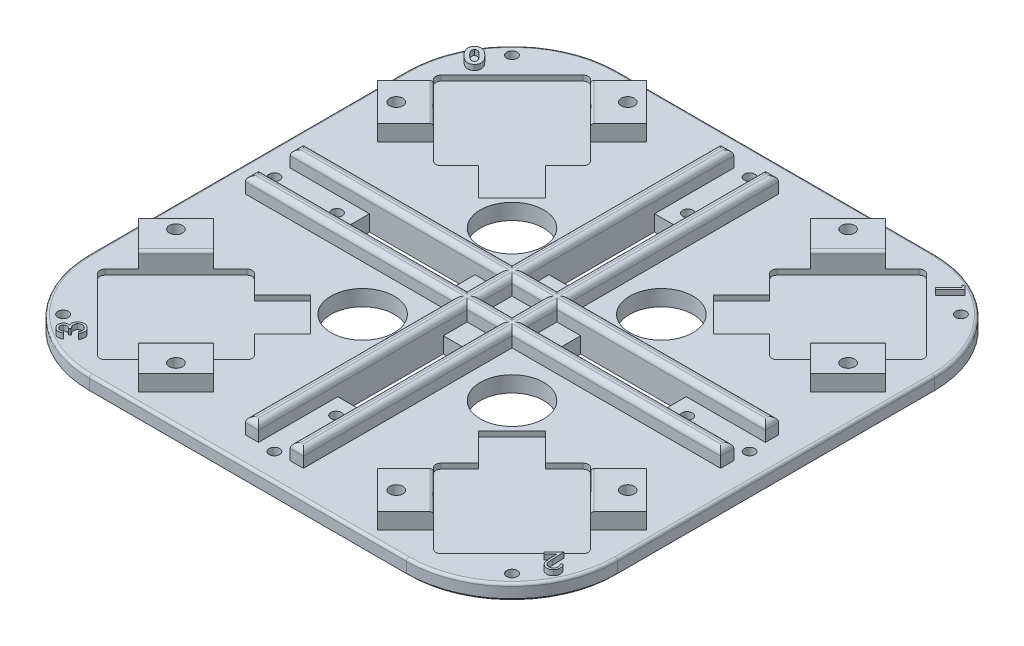
from build123d import *

# Parameters (mm, degrees)
SKETCH_1_W          = 200
SKETCH_1_H          = 200
SKETCH_1_R          = 2
EXTRUDE_1_DEPTH     = 6
CUT_EXTRUDE_1_DEPTH = 2
FILLET_1_R          = 2
EXTRUDE_3_DEPTH     = 6
FILLET_4_R          = 40
SKETCH_4_R          = 2.5
CUT_EXTRUDE_2_DEPTH = 8
SKETCH_5_W          = 5
SKETCH_5_H          = 180
EXTRUDE_4_DEPTH     = 6
SKETCH_6_W          = 180
SKETCH_6_H          = 5
EXTRUDE_5_DEPTH     = 6
FILLET_5_R          = 2
SKETCH_7_R          = 12
SKETCH_7_W          = 40
SKETCH_7_H          = 12
SKETCH_7_W_2        = 12
SKETCH_7_H_2        = 40
CUT_EXTRUDE_3_DEPTH = 6
CUT_EXTRUDE_4_DEPTH = 2
FILLET_6_R          = 1
SKETCH_9_R          = 2
CUT_EXTRUDE_5_DEPTH = 10
EXTRUDE_6_DEPTH     = 2
FILLET_9_R          = 1
CHAMFER_1_SIZE      = 1


with BuildPart() as part:
    # Эскиз1 → Бобышка-Вытянуть1 (new body)
    with BuildSketch(Plane(origin=(0, 0, 0), x_dir=(1, 0, 0), z_dir=(0, 1, 0))):
        Rectangle(SKETCH_1_W, SKETCH_1_H)
        with Locations((-90, 0)):
            Circle(SKETCH_1_R, mode=Mode.SUBTRACT)
        with Locations((0, 90)):
            Circle(SKETCH_1_R, mode=Mode.SUBTRACT)
        with Locations((90, 0)):
            Circle(SKETCH_1_R, mode=Mode.SUBTRACT)
        with Locations((0, -90)):
            Circle(SKETCH_1_R, mode=Mode.SUBTRACT)
        with Locations((-85, 85)):
            Circle(SKETCH_1_R, mode=Mode.SUBTRACT)
        with Locations((85, 85)):
            Circle(SKETCH_1_R, mode=Mode.SUBTRACT)
        with Locations((85, -85)):
            Circle(SKETCH_1_R, mode=Mode.SUBTRACT)
        with Locations((-85, -85)):
            Circle(SKETCH_1_R, mode=Mode.SUBTRACT)
    extrude(amount=EXTRUDE_1_DEPTH)

    # Эскиз2 → Вырез-Вытянуть1 (cut)
    with BuildSketch(Plane(origin=(0, 6, 0), x_dir=(1, 0, 0), z_dir=(0, 1, 0))):
        Polygon((63.639610307, 33.941125497), (33.941125497, 63.639610307), (63.639610307, 93.338095117), (93.338095117, 63.639610307), align=None)
        Polygon((33.941125497, -63.639610307), (63.639610307, -33.941125497), (93.338095117, -63.639610307), (63.639610307, -93.338095117), align=None)
        Polygon((-63.639610307, -33.941125497), (-33.941125497, -63.639610307), (-63.639610307, -93.338095117), (-93.338095117, -63.639610307), align=None)
        Polygon((-33.941125497, 63.639610307), (-63.639610307, 33.941125497), (-93.338095117, 63.639610307), (-63.639610307, 93.338095117), align=None)
    extrude(amount=-CUT_EXTRUDE_1_DEPTH, mode=Mode.SUBTRACT)

    # Скругление1
    fillet_1_edges = [part.edges().sort_by_distance(p)[0] for p in [
        (63.639610307, 5, -33.941125497),
        (33.941125497, 5, -63.639610307),
        (93.338095117, 5, -63.639610307),
        (63.639610307, 5, -93.338095117),
        (-63.639610307, 5, -93.338095117),
        (-63.639610307, 5, -33.941125497),
        (-93.338095117, 5, -63.639610307),
        (-33.941125497, 5, -63.639610307),
        (63.639610307, 5, 93.338095117),
        (93.338095117, 5, 63.639610307),
        (63.639610307, 5, 33.941125497),
        (33.941125497, 5, 63.639610307),
        (-63.639610307, 5, 93.338095117),
        (-33.941125497, 5, 63.639610307),
        (-63.639610307, 5, 33.941125497),
        (-93.338095117, 5, 63.639610307),
    ]]
    fillet(fillet_1_edges, radius=FILLET_1_R)

    # Эскиз3 → Бобышка-Вытянуть3 (add)
    with BuildSketch(Plane(origin=(0, 6, 0), x_dir=(1, 0, 0), z_dir=(0, 1, 0))):
        Polygon((41.71930009, 71.4177849), (55.861435714, 85.559920524), (45.254833996, 96.166522241), (31.112698372, 82.024386618), align=None)
        Polygon((85.559920524, 55.861435714), (96.166522241, 45.254833996), (82.024386618, 31.112698372), (71.4177849, 41.71930009), align=None)
        Polygon((71.4177849, -41.71930009), (85.559920524, -55.861435714), (96.166522241, -45.254833996), (82.024386618, -31.112698372), align=None)
        Polygon((31.112698372, -82.024386618), (45.254833996, -96.166522241), (55.861435714, -85.559920524), (41.71930009, -71.4177849), align=None)
        Polygon((-41.71930009, -71.4177849), (-55.861435714, -85.559920524), (-45.254833996, -96.166522241), (-31.112698372, -82.024386618), align=None)
        Polygon((-85.559920524, -55.861435714), (-96.166522241, -45.254833996), (-82.024386618, -31.112698372), (-71.4177849, -41.71930009), align=None)
        Polygon((-71.4177849, 41.71930009), (-85.559920524, 55.861435714), (-96.166522241, 45.254833996), (-82.024386618, 31.112698372), align=None)
        Polygon((-31.112698372, 82.024386618), (-45.254833996, 96.166522241), (-55.861435714, 85.559920524), (-41.71930009, 71.4177849), align=None)
    extrude(amount=EXTRUDE_3_DEPTH)

    # Скругление4
    fillet_4_edges = [part.edges().sort_by_distance(p)[0] for p in [
        (100, 3, -100),
        (100, 3, 100),
        (-100, 3, 100),
        (-100, 3, -100),
    ]]
    fillet(fillet_4_edges, radius=FILLET_4_R)

    # Эскиз4 → Вырез-Вытянуть2 (cut)
    with BuildSketch(Plane(origin=(0, 12, 0), x_dir=(1, 0, 0), z_dir=(0, 1, 0))):
        with Locations((41.71930009, 85.559920524)):
            Circle(SKETCH_4_R)
        with Locations((85.559920524, 41.71930009)):
            Circle(SKETCH_4_R)
        with Locations((85.559920524, -41.71930009)):
            Circle(SKETCH_4_R)
        with Locations((41.71930009, -85.559920524)):
            Circle(SKETCH_4_R)
        with Locations((-41.71930009, -85.559920524)):
            Circle(SKETCH_4_R)
        with Locations((-85.559920524, -41.71930009)):
            Circle(SKETCH_4_R)
        with Locations((-85.559920524, 41.71930009)):
            Circle(SKETCH_4_R)
        with Locations((-41.71930009, 85.559920524)):
            Circle(SKETCH_4_R)
    extrude(amount=-CUT_EXTRUDE_2_DEPTH, mode=Mode.SUBTRACT)

    # Эскиз5 → Бобышка-Вытянуть4 (add)
    with BuildSketch(Plane(origin=(0, 6, 0), x_dir=(1, 0, 0), z_dir=(0, 1, 0))):
        with Locations((-8.5, 0)):
            Rectangle(SKETCH_5_W, SKETCH_5_H)
        with Locations((8.5, 0)):
            Rectangle(SKETCH_5_W, SKETCH_5_H)
    extrude(amount=EXTRUDE_4_DEPTH)

    # Эскиз6 → Бобышка-Вытянуть5 (add)
    with BuildSketch(Plane(origin=(0, 6, 0), x_dir=(1, 0, 0), z_dir=(0, 1, 0))):
        with Locations((0, 8.5)):
            Rectangle(SKETCH_6_W, SKETCH_6_H)
        with Locations((0, -8.5)):
            Rectangle(SKETCH_6_W, SKETCH_6_H)
    extrude(amount=EXTRUDE_5_DEPTH)

    # Скругление5
    fillet_5_edges = [part.edges().sort_by_distance(p)[0] for p in [
        (-8.5, 12, 90),
        (-11, 12, -50.5),
        (-11, 12, 50.5),
        (-8.5, 12, -90),
        (-6, 12, -50.5),
        (-6, 12, 50.5),
        (8.5, 12, 90),
        (6, 12, -50.5),
        (6, 12, 50.5),
        (8.5, 12, -90),
        (11, 12, -50.5),
        (11, 12, 50.5),
        (0, 12, -6),
        (-6, 12, 0),
        (0, 12, 6),
        (6, 12, 0),
        (-50.5, 12, 11),
        (-90, 12, 8.5),
        (-50.5, 12, 6),
        (-11, 12, 0),
        (-50.5, 12, -6),
        (-90, 12, -8.5),
        (-50.5, 12, -11),
        (0, 12, -11),
        (50.5, 12, -11),
        (90, 12, -8.5),
        (50.5, 12, -6),
        (11, 12, 0),
        (50.5, 12, 6),
        (90, 12, 8.5),
        (50.5, 12, 11),
        (0, 12, 11),
    ]]
    fillet(fillet_5_edges, radius=FILLET_5_R)

    # Эскиз7 → Вырез-Вытянуть3 (cut)
    with BuildSketch(Plane(origin=(0, 6, 0), x_dir=(1, 0, 0), z_dir=(0, 1, 0))):
        with Locations((28.284271247, 28.284271247)):
            Circle(SKETCH_7_R)
        with Locations((28.284271247, -28.284271247)):
            Circle(SKETCH_7_R)
        with Locations((-28.284271247, -28.284271247)):
            Circle(SKETCH_7_R)
        with Locations((-28.284271247, 28.284271247)):
            Circle(SKETCH_7_R)
        with Locations((40, 0)):
            Rectangle(SKETCH_7_W, SKETCH_7_H)
        with Locations((0, 40)):
            Rectangle(SKETCH_7_W_2, SKETCH_7_H_2)
        with Locations((0, -40)):
            Rectangle(SKETCH_7_W_2, SKETCH_7_H_2)
        with Locations((-40, 0)):
            Rectangle(SKETCH_7_W, SKETCH_7_H)
    extrude(amount=-CUT_EXTRUDE_3_DEPTH, mode=Mode.SUBTRACT)

    # Эскиз8 → Вырез-Вытянуть4 (cut)
    with BuildSketch(Plane(origin=(0, 6, 0), x_dir=(1, 0, 0), z_dir=(0, 1, 0))):
        Polygon((44.547727215, 31.819805153), (31.819805153, 44.547727215), (53.033008589, 65.76093065), (65.76093065, 53.033008589), align=None)
        Polygon((65.76093065, -53.033008589), (53.033008589, -65.76093065), (31.819805153, -44.547727215), (44.547727215, -31.819805153), align=None)
        Polygon((-44.547727215, -31.819805153), (-31.819805153, -44.547727215), (-53.033008589, -65.76093065), (-65.76093065, -53.033008589), align=None)
        Polygon((-65.76093065, 53.033008589), (-53.033008589, 65.76093065), (-31.819805153, 44.547727215), (-44.547727215, 31.819805153), align=None)
    extrude(amount=-CUT_EXTRUDE_4_DEPTH, mode=Mode.SUBTRACT)

    # Скругление6
    fillet_6_edges = [part.edges().sort_by_distance(p)[0] for p in [
        (78.488852712, 12, -48.790367902),
        (48.790367902, 12, -78.488852712),
        (-78.488852712, 12, 48.790367902),
        (-48.790367902, 12, 78.488852712),
        (48.790367902, 12, 78.488852712),
        (78.488852712, 12, 48.790367902),
        (-78.488852712, 12, -48.790367902),
        (-48.790367902, 12, -78.488852712),
    ]]
    fillet(fillet_6_edges, radius=FILLET_6_R)

    # Эскиз9 → Вырез-Вытянуть5 (cut)
    with BuildSketch(Plane(origin=(0, 6, 0), x_dir=(1, 0, 0), z_dir=(0, 1, 0))):
        with Locations((0.141931936, 66.467885895)):
            Circle(SKETCH_9_R)
        with Locations((-0.141931936, -66.467885895)):
            Circle(SKETCH_9_R)
        with Locations((66.467885895, -0.141931936)):
            Circle(SKETCH_9_R)
        with Locations((-66.467885895, 0.141931936)):
            Circle(SKETCH_9_R)
    extrude(amount=-CUT_EXTRUDE_5_DEPTH, mode=Mode.SUBTRACT)

    # Эскиз10 → Бобышка-Вытянуть6 (add)
    # profile 1 of 4: a face of its own
    with BuildSketch(Plane(origin=(0, 6, 0), x_dir=(1, 0, 0), z_dir=(0, 1, 0))):
        with BuildLine():
            add(Edge.make_bspline(
                [(-93.008725725, 78.748142248), (-92.957598681, 78.797521313), (-92.85676014, 78.894912293), (-92.695816741, 79.025623668), (-92.532835835, 79.143607747), (-92.364444707, 79.244705894), (-92.19338747, 79.333809788), (-92.016821516, 79.405990635), (-91.83577231, 79.461704551), (-91.651864556, 79.505826632), (-91.463065577, 79.533008597), (-91.270612251, 79.544105355), (-91.074440499, 79.539176393), (-90.875174478, 79.51794816), (-90.671949254, 79.481192006), (-90.46586329, 79.425437226), (-90.254902601, 79.357171516), (-90.040488058, 79.269212477), (-89.819864955, 79.163420892), (-89.593527751, 79.033863441), (-89.359570967, 78.882570897), (-89.117138773, 78.709656313), (-88.869800196, 78.51114685), (-88.612296924, 78.293135309), (-88.348308293, 78.050855484), (-88.172747767, 77.8784765), (-88.082443673, 77.789808915)],
                knots=[0, 0, 0, 0, 0.898182766, 1.771497688, 2.618542862, 3.439672004, 4.25211909, 5.054711465, 5.847125212, 6.644844624, 7.443249755, 8.254994895, 9.079117631, 9.921086753, 10.786032602, 11.686927653, 12.618018076, 13.587382576, 14.61431454, 15.709081657, 16.881705886, 18.135395254, 19.471648796, 20.88972771, 22.400151059, 24, 24, 24, 24], degree=3))
            add(Edge.make_bspline(
                [(-88.082443673, 77.789808915), (-87.99267599, 77.698463012), (-87.818629055, 77.521356129), (-87.574075163, 77.254376099), (-87.352755723, 76.995556331), (-87.155322982, 76.743444497), (-86.979453593, 76.499753648), (-86.827635494, 76.263265193), (-86.697172812, 76.035199404), (-86.593983854, 75.812528771), (-86.505762897, 75.597863606), (-86.435650692, 75.388405368), (-86.380204903, 75.184114783), (-86.341999183, 74.984749296), (-86.317124562, 74.790489333), (-86.308824987, 74.600690128), (-86.317259045, 74.415819605), (-86.339029871, 74.235495262), (-86.378224262, 74.059121756), (-86.433011633, 73.88543721), (-86.503667028, 73.713843244), (-86.590455303, 73.544917992), (-86.694786221, 73.379663841), (-86.810937292, 73.213769659), (-86.94605157, 73.051911723), (-87.045954632, 72.949414733), (-87.09686675, 72.89718071)],
                knots=[0, 0, 0, 0, 1.626693129, 3.153929617, 4.597923221, 5.951226613, 7.220381534, 8.41370076, 9.519612414, 10.554665343, 11.5286677, 12.466351198, 13.358440621, 14.215441504, 15.042756246, 15.844148676, 16.625203713, 17.391079629, 18.148401381, 18.916678168, 19.701702082, 20.502864672, 21.325687275, 22.182312009, 23.073678591, 24, 24, 24, 24], degree=3))
            add(Edge.make_bspline(
                [(-87.09686675, 72.89718071), (-87.149001816, 72.84614528), (-87.251598834, 72.745712247), (-87.415449357, 72.611920711), (-87.581095452, 72.493010238), (-87.748111845, 72.387124201), (-87.920307836, 72.299502255), (-88.094627597, 72.225293141), (-88.272021467, 72.16710318), (-88.452198674, 72.125173685), (-88.635693302, 72.099819479), (-88.822639538, 72.088904452), (-89.013082719, 72.090828854), (-89.207091086, 72.1143069), (-89.40536909, 72.145719544), (-89.606567507, 72.199199877), (-89.811492576, 72.264759097), (-90.022238393, 72.344954071), (-90.237893224, 72.447094582), (-90.460693886, 72.571345842), (-90.692551034, 72.717439447), (-90.930254984, 72.890031869), (-91.177219561, 73.084109407), (-91.432290045, 73.301626079), (-91.696875667, 73.541020342), (-91.871055441, 73.713771109), (-91.960648802, 73.802629428)],
                knots=[0, 0, 0, 0, 0.933090558, 1.836236452, 2.703091185, 3.541342316, 4.363641911, 5.172278286, 5.963363672, 6.749235136, 7.536057157, 8.330354457, 9.143829215, 9.968822976, 10.828425831, 11.710347207, 12.629007139, 13.581006501, 14.593064946, 15.679156618, 16.843448976, 18.097249152, 19.435871615, 20.861513249, 22.385647378, 24, 24, 24, 24], degree=3))
            add(Edge.make_bspline(
                [(-91.960648802, 73.802629428), (-92.083808079, 73.927961036), (-92.321358131, 74.169701086), (-92.642974702, 74.539928393), (-92.927306321, 74.894846854), (-93.16830981, 75.240335887), (-93.371354338, 75.572879883), (-93.528165963, 75.896472645), (-93.650478298, 76.206379417), (-93.697573804, 76.414092671), (-93.720264186, 76.514167889)],
                knots=[0, 0, 0, 0, 1.286987725, 2.482346486, 3.591022616, 4.616940247, 5.566609133, 6.441717498, 7.249227199, 8, 8, 8, 8], degree=3))
            add(Edge.make_bspline(
                [(-93.720264186, 76.514167889), (-93.73621609, 76.619695189), (-93.767435565, 76.826222703), (-93.769463604, 77.134773214), (-93.73708647, 77.432890992), (-93.662918531, 77.719164849), (-93.557667587, 77.996586653), (-93.410830123, 78.260518954), (-93.228823871, 78.514820834), (-93.083287813, 78.669100547), (-93.008725725, 78.748142248)],
                knots=[0, 0, 0, 0, 1.045976366, 2.04708071, 3.017702948, 3.979968869, 4.940634868, 5.921098241, 6.93492198, 8, 8, 8, 8], degree=3))
        make_face()
        with BuildLine():
            add(Edge.make_bspline(
                [(-91.968661622, 77.762565325), (-92.010462791, 77.716369621), (-92.09267178, 77.625518043), (-92.185599358, 77.466056849), (-92.247808891, 77.292789759), (-92.277000053, 77.138763868), (-92.281564988, 77.009210942), (-92.272569584, 76.906266824), (-92.255217222, 76.798367336), (-92.225720447, 76.685914195), (-92.185705795, 76.569081549), (-92.133366823, 76.447952044), (-92.070623007, 76.322116087), (-91.998518706, 76.18904091), (-91.910791112, 76.051145738), (-91.80930652, 75.904601817), (-91.691866402, 75.749325648), (-91.559047432, 75.584504399), (-91.409818285, 75.411433598), (-91.243944165, 75.230965793), (-91.065124091, 75.039589219), (-90.938036359, 74.911792703), (-90.872507776, 74.845898658)],
                knots=[0, 0, 0, 0, 1.075604722, 2.115356592, 3.167844591, 4.248203041, 4.812243559, 5.405508209, 6.032984943, 6.700942317, 7.414044194, 8.167617197, 8.981822607, 9.846245724, 10.784711884, 11.80756956, 12.929501316, 14.151980212, 15.469127066, 16.882155306, 18.392386567, 20, 20, 20, 20], degree=3))
            add(Edge.make_bspline(
                [(-90.872507776, 74.845898658), (-90.7864976, 74.761480543), (-90.621676348, 74.599710156), (-90.376186673, 74.375708535), (-90.142591105, 74.181411662), (-89.920993001, 74.01580443), (-89.712979922, 73.876185004), (-89.516195184, 73.766835437), (-89.332031918, 73.684611929), (-89.159202852, 73.630270157), (-88.995766399, 73.602382197), (-88.842298, 73.587529693), (-88.696426487, 73.594737092), (-88.558484062, 73.616713591), (-88.427977695, 73.656297414), (-88.306707853, 73.716054158), (-88.190628178, 73.788553381), (-88.124171611, 73.852114178), (-88.090456494, 73.884360197)],
                knots=[0, 0, 0, 0, 1.768629636, 3.389223978, 4.875842697, 6.225868878, 7.447880289, 8.54973518, 9.52566295, 10.403516369, 11.200100902, 11.95533547, 12.661618695, 13.336984531, 14.001570975, 14.653788248, 15.317032326, 16, 16, 16, 16], degree=3))
            add(Edge.make_bspline(
                [(-88.090456494, 73.884360197), (-88.060170206, 73.917273087), (-88.000655379, 73.981949384), (-87.928154313, 74.090301918), (-87.872339217, 74.205569408), (-87.835909962, 74.32905055), (-87.814669853, 74.458862384), (-87.812602281, 74.595619521), (-87.824773104, 74.739340345), (-87.846722465, 74.835951399), (-87.858084699, 74.885962761)],
                knots=[0, 0, 0, 0, 0.992959701, 1.951240279, 2.885912978, 3.828695135, 4.802734124, 5.800367936, 6.861345669, 8, 8, 8, 8], degree=3))
            add(Edge.make_bspline(
                [(-87.858084699, 74.885962761), (-87.877060945, 74.949998607), (-87.916921532, 75.084509222), (-88.007273396, 75.286598194), (-88.126064612, 75.49901867), (-88.272102307, 75.722527903), (-88.44647396, 75.957027887), (-88.648604001, 76.202021519), (-88.880645166, 76.45665197), (-89.04719527, 76.627386506), (-89.133725725, 76.716090966)],
                knots=[0, 0, 0, 0, 0.710523542, 1.492491535, 2.35044932, 3.300180637, 4.333113065, 5.460466168, 6.680595133, 8, 8, 8, 8], degree=3))
            add(Edge.make_bspline(
                [(-89.133725725, 76.716090966), (-89.222964963, 76.803682764), (-89.394241612, 76.971797487), (-89.648507303, 77.205255058), (-89.891423716, 77.406883944), (-90.117816027, 77.583359819), (-90.333231584, 77.728162558), (-90.534384646, 77.845045557), (-90.723026558, 77.930887678), (-90.898556487, 77.990917344), (-91.063656834, 78.023876163), (-91.218731192, 78.040982929), (-91.365199368, 78.039958248), (-91.503588791, 78.020388828), (-91.63445609, 77.984561165), (-91.755276867, 77.926461343), (-91.869565032, 77.855138121), (-91.935391485, 77.793645199), (-91.968661622, 77.762565325)],
                knots=[0, 0, 0, 0, 1.794997963, 3.44513516, 4.953227072, 6.325945798, 7.563759521, 8.676594079, 9.661550624, 10.534529874, 11.333105772, 12.073249666, 12.771110835, 13.429383314, 14.075074024, 14.709742177, 15.347875331, 16, 16, 16, 16], degree=3))
        make_face(mode=Mode.SUBTRACT)
    # profile 2 of 4: a face of its own
    with BuildSketch(Plane(origin=(0, 6, 0), x_dir=(1, 0, 0), z_dir=(0, 1, 0))):
        Polygon((78.440095754, 93.074368887), (79.541057292, 91.973407348), (73.941698318, 86.374048374), (73.385608575, 86.930138118), (78.436890626, 91.981420169), (77.557082933, 92.861227861), align=None)
    # profile 3 of 4: a face of its own
    with BuildSketch(Plane(origin=(0, 6, 0), x_dir=(1, 0, 0), z_dir=(0, 1, 0))):
        with BuildLine():
            Line((92.978731613, -74.683298044), (93.515590587, -74.14643907))
            add(Edge.make_bspline(
                [(93.515590587, -74.14643907), (93.57979168, -74.217561095), (93.705938599, -74.357306758), (93.872192198, -74.580565611), (94.0096643, -74.812483922), (94.124946647, -75.049578001), (94.215404454, -75.292959176), (94.277694742, -75.544127868), (94.316788413, -75.801118589), (94.328555137, -76.062538369), (94.318422495, -76.32287574), (94.281216893, -76.576781617), (94.220051936, -76.822145442), (94.134830229, -77.05845039), (94.025582223, -77.28616355), (93.889081572, -77.503018406), (93.730477042, -77.712924928), (93.608225903, -77.841999489), (93.546039305, -77.907657019)],
                knots=[0, 0, 0, 0, 1.097080493, 2.155622548, 3.181877021, 4.180734131, 5.171877943, 6.149826956, 7.139761318, 8.144411119, 9.14266836, 10.119602376, 11.078258423, 12.0343727, 12.992188754, 13.965052194, 14.964864601, 16, 16, 16, 16], degree=3))
            add(Edge.make_bspline(
                [(93.546039305, -77.907657019), (93.482090698, -77.969428879), (93.356687631, -78.090563349), (93.151429875, -78.244882669), (92.942680032, -78.37895674), (92.725313898, -78.484156569), (92.502307063, -78.567304392), (92.272879379, -78.625036467), (92.036408861, -78.657581549), (91.796858495, -78.662803423), (91.558717577, -78.647071576), (91.328114136, -78.610221179), (91.106309941, -78.554059657), (90.894170445, -78.476955727), (90.69100415, -78.378911034), (90.498450265, -78.258608397), (90.312382857, -78.122050971), (90.200365868, -78.014736799), (90.143795716, -77.960541634)],
                knots=[0, 0, 0, 0, 1.122093018, 2.200421744, 3.237554738, 4.251534574, 5.244276876, 6.239309773, 7.233678941, 8.25294369, 9.26061734, 10.244606756, 11.198736813, 12.14649875, 13.09110873, 14.042419092, 15.011394142, 16, 16, 16, 16], degree=3))
            add(Edge.make_bspline(
                [(90.143795716, -77.960541634), (90.06838982, -77.879576092), (89.91877248, -77.718927525), (89.733967572, -77.445845524), (89.584072127, -77.153182093), (89.489411425, -76.889885212), (89.430647816, -76.660895349), (89.391527922, -76.464896649), (89.354319473, -76.246967695), (89.323162154, -76.005743563), (89.29417061, -75.742397125), (89.270319478, -75.45596892), (89.251579707, -75.147093558), (89.241802351, -74.933312205), (89.236744434, -74.822721121)],
                knots=[0, 0, 0, 0, 1.186803905, 2.354808508, 3.527369274, 4.71059022, 5.350674727, 6.065137202, 6.856453041, 7.724624025, 8.676850923, 9.701662735, 10.811048734, 12, 12, 12, 12], degree=3))
            Line((89.236744434, -74.822721121), (89.12616751, -71.926887788))
            Line((89.12616751, -71.926887788), (86.541231613, -74.511823685))
            Line((86.541231613, -74.511823685), (86.00116751, -73.971759583))
            Line((86.00116751, -73.971759583), (89.804052126, -70.168874967))
            Line((89.804052126, -70.168874967), (89.975526485, -74.61919548))
            add(Edge.make_bspline(
                [(89.975526485, -74.61919548), (89.97940604, -74.72712057), (89.986860215, -74.934487794), (90.003890674, -75.233029494), (90.019624168, -75.50625937), (90.043566004, -75.75394261), (90.06564968, -75.976592217), (90.095425878, -76.173535946), (90.124676221, -76.345461481), (90.168824981, -76.538523396), (90.23936523, -76.755529595), (90.356972999, -76.992365375), (90.498540406, -77.21240251), (90.616674642, -77.339291696), (90.675846998, -77.402849326)],
                knots=[0, 0, 0, 0, 1.320717269, 2.537625612, 3.657091802, 4.667335419, 5.580706193, 6.392834347, 7.10280944, 7.712944814, 8.814093938, 9.883466006, 10.93984752, 12, 12, 12, 12], degree=3))
            add(Edge.make_bspline(
                [(90.675846998, -77.402849326), (90.715762518, -77.440491138), (90.794563147, -77.514803044), (90.923578393, -77.611670036), (91.059857654, -77.691744666), (91.203081359, -77.756245876), (91.352325662, -77.808417727), (91.509417042, -77.84322442), (91.673171622, -77.86207557), (91.841072337, -77.867216475), (92.009961942, -77.855516387), (92.175462222, -77.830692716), (92.335424905, -77.788442162), (92.488974446, -77.730963732), (92.63686883, -77.65745526), (92.779385889, -77.569475576), (92.916642426, -77.465111951), (93.000335801, -77.384492124), (93.042834177, -77.343554455)],
                knots=[0, 0, 0, 0, 0.999414226, 1.973028734, 2.933162718, 3.874301026, 4.831864631, 5.809753659, 6.800020608, 7.832465231, 8.866744497, 9.881594604, 10.878159325, 11.876387246, 12.86478581, 13.883411814, 14.925224832, 16, 16, 16, 16], degree=3))
            add(Edge.make_bspline(
                [(93.042834177, -77.343554455), (93.085971983, -77.29897834), (93.170746275, -77.211377487), (93.280021317, -77.067662313), (93.371539202, -76.917986932), (93.447322526, -76.763501475), (93.507260364, -76.604334053), (93.549404033, -76.439373624), (93.572814515, -76.2684341), (93.581008072, -76.093006632), (93.571727119, -75.914621837), (93.542273015, -75.73648388), (93.495192881, -75.558323393), (93.430044659, -75.380806329), (93.34279892, -75.20509369), (93.240953397, -75.028485632), (93.118160612, -74.853500614), (93.025950971, -74.740939253), (92.978731613, -74.683298044)],
                knots=[0, 0, 0, 0, 1.00435318, 1.973751999, 2.917821866, 3.842935876, 4.757667598, 5.668706735, 6.595277109, 7.548310303, 8.510417973, 9.48367281, 10.468252952, 11.4923997, 12.541405892, 13.642871744, 14.792945286, 16, 16, 16, 16], degree=3))
        make_face()
    # profile 4 of 4: a face of its own
    with BuildSketch(Plane(origin=(0, 6, 0), x_dir=(1, 0, 0), z_dir=(0, 1, 0))):
        with BuildLine():
            Line((-77.388715553, -92.454657468), (-76.802177092, -93.02196516))
            add(Edge.make_bspline(
                [(-76.802177092, -93.02196516), (-76.872074017, -93.066285105), (-77.009193948, -93.153229528), (-77.221245979, -93.263222601), (-77.431874401, -93.355769168), (-77.64204283, -93.427893024), (-77.851510765, -93.48173737), (-78.060252855, -93.514710119), (-78.26822027, -93.532269537), (-78.474255518, -93.526358935), (-78.676988968, -93.504358079), (-78.873717005, -93.464118869), (-79.064802464, -93.407793132), (-79.248731568, -93.334076039), (-79.426690369, -93.243281798), (-79.598271698, -93.136210179), (-79.762535153, -93.010024629), (-79.865353835, -92.915908177), (-79.917561707, -92.868119006)],
                knots=[0, 0, 0, 0, 1.169279398, 2.293827799, 3.37245145, 4.41823223, 5.430864929, 6.42509182, 7.401967133, 8.376183799, 9.33334128, 10.280982312, 11.210249107, 12.145386172, 13.077317515, 14.030476502, 14.999942152, 16, 16, 16, 16], degree=3))
            add(Edge.make_bspline(
                [(-79.917561707, -92.868119006), (-79.988920031, -92.793915351), (-80.13012374, -92.647081306), (-80.306994952, -92.399433841), (-80.450747659, -92.133673041), (-80.562173881, -91.854130293), (-80.638288532, -91.566288195), (-80.673674749, -91.278376936), (-80.670891848, -90.993695007), (-80.628901464, -90.716257597), (-80.552855322, -90.450259759), (-80.442808141, -90.204893605), (-80.306804124, -89.977972028), (-80.190611, -89.848268388), (-80.132305297, -89.783183109)],
                knots=[0, 0, 0, 0, 1.079631469, 2.136372602, 3.182766178, 4.244954198, 5.288217467, 6.299582755, 7.281027378, 8.267633372, 9.236679149, 10.175611233, 11.084521819, 12, 12, 12, 12], degree=3))
            add(Edge.make_bspline(
                [(-80.132305297, -89.783183109), (-80.071332651, -89.724753249), (-79.951762443, -89.610169563), (-79.748381213, -89.471190926), (-79.532010491, -89.364348043), (-79.301508127, -89.289802953), (-79.057050132, -89.248329314), (-78.799158916, -89.239790928), (-78.527911531, -89.261925886), (-78.346160961, -89.301335363), (-78.252497604, -89.321644647)],
                knots=[0, 0, 0, 0, 0.994959293, 1.951161675, 2.892524362, 3.833211752, 4.798837926, 5.80788833, 6.870316961, 8, 8, 8, 8], degree=3))
            add(Edge.make_bspline(
                [(-78.252497604, -89.321644647), (-78.2908941, -89.227417901), (-78.366455678, -89.04198635), (-78.433533784, -88.752543136), (-78.468825619, -88.462397129), (-78.460297874, -88.26936548), (-78.456023245, -88.172606186)],
                knots=[0, 0, 0, 0, 1.034463078, 2.035749934, 3.015397462, 4, 4, 4, 4], degree=3))
            add(Edge.make_bspline(
                [(-78.456023245, -88.172606186), (-78.449288881, -88.105111251), (-78.436049064, -87.972415657), (-78.394386167, -87.778644977), (-78.340246105, -87.592612574), (-78.271950602, -87.41388508), (-78.185386109, -87.244752842), (-78.086329088, -87.082127181), (-77.970712952, -86.92772678), (-77.883148966, -86.832672184), (-77.839036066, -86.784785673)],
                knots=[0, 0, 0, 0, 1.04938919, 2.063107758, 3.062796941, 4.047250166, 5.019961658, 6.00006311, 6.992473739, 8, 8, 8, 8], degree=3))
            add(Edge.make_bspline(
                [(-77.839036066, -86.784785673), (-77.757764137, -86.707011683), (-77.595555492, -86.551784486), (-77.314339011, -86.362283402), (-77.00690324, -86.211377214), (-76.678775657, -86.096957633), (-76.337780488, -86.021689696), (-75.992384551, -85.998456457), (-75.648247161, -86.020429174), (-75.30852581, -86.092358394), (-74.975836653, -86.206866008), (-74.658919531, -86.369981879), (-74.355276993, -86.571977286), (-74.173558247, -86.737405252), (-74.081023245, -86.821644647)],
                knots=[0, 0, 0, 0, 0.966121529, 1.928258222, 2.902202989, 3.904812497, 4.910491246, 5.896124049, 6.872277065, 7.867065951, 8.874013802, 9.889062967, 10.92506653, 12, 12, 12, 12], degree=3))
            add(Edge.make_bspline(
                [(-74.081023245, -86.821644647), (-74.021853204, -86.881667927), (-73.905378738, -86.999821968), (-73.750010399, -87.188779842), (-73.616060265, -87.384318945), (-73.501384782, -87.584883398), (-73.407951202, -87.792558543), (-73.335758423, -88.006211938), (-73.283928402, -88.225649401), (-73.254012973, -88.449994375), (-73.243405037, -88.678597891), (-73.258616666, -88.909429614), (-73.295934925, -89.142204022), (-73.356030565, -89.376896446), (-73.437638527, -89.614740521), (-73.544783279, -89.853551775), (-73.672760277, -90.094886692), (-73.773237898, -90.251289766), (-73.824612989, -90.331260032)],
                knots=[0, 0, 0, 0, 1.045386523, 2.057812277, 3.030335339, 3.9831449, 4.920592867, 5.851197628, 6.777212156, 7.713628621, 8.655634425, 9.611918591, 10.578438017, 11.576706329, 12.614247281, 13.694355822, 14.821103873, 16, 16, 16, 16], degree=3))
            Line((-73.824612989, -90.331260032), (-74.387112989, -89.786388237))
            add(Edge.make_bspline(
                [(-74.387112989, -89.786388237), (-74.356108499, -89.729521047), (-74.295703021, -89.618727748), (-74.216755615, -89.452142222), (-74.152845056, -89.290175233), (-74.101233485, -89.134547193), (-74.061745375, -88.985413058), (-74.03787435, -88.841628771), (-74.0254386, -88.703252914), (-74.028325632, -88.612793387), (-74.029741194, -88.568439519)],
                knots=[0, 0, 0, 0, 1.208474665, 2.354448952, 3.437297787, 4.455450756, 5.412846772, 6.31251137, 7.172595194, 8, 8, 8, 8], degree=3))
            add(Edge.make_bspline(
                [(-74.029741194, -88.568439519), (-74.034859604, -88.513754216), (-74.045091811, -88.404432883), (-74.083607887, -88.244282225), (-74.135192606, -88.087829609), (-74.200435306, -87.934539232), (-74.284661095, -87.786835222), (-74.385183264, -87.644176856), (-74.498874455, -87.503469008), (-74.585051384, -87.416022074), (-74.629100169, -87.371324134)],
                knots=[0, 0, 0, 0, 0.961215761, 1.921565418, 2.877526972, 3.845915068, 4.834977089, 5.850130758, 6.901108131, 8, 8, 8, 8], degree=3))
            add(Edge.make_bspline(
                [(-74.629100169, -87.371324134), (-74.681090431, -87.322723333), (-74.782445027, -87.227976466), (-74.946347893, -87.106489871), (-75.110690459, -87.000747278), (-75.281027643, -86.917143209), (-75.454113249, -86.850977835), (-75.631241254, -86.803553156), (-75.812608999, -86.778698861), (-75.995053098, -86.770559067), (-76.175866677, -86.78030301), (-76.350156794, -86.805831688), (-76.517207594, -86.845992364), (-76.675973132, -86.901663669), (-76.826644699, -86.974919386), (-76.969041379, -87.0634642), (-77.105388267, -87.165921189), (-77.187099009, -87.245903166), (-77.228459143, -87.286388237)],
                knots=[0, 0, 0, 0, 1.175407728, 2.291447812, 3.366826222, 4.401376563, 5.421356114, 6.425777831, 7.424712672, 8.441055237, 9.440185163, 10.412905177, 11.348740396, 12.27587154, 13.188083527, 14.111845111, 15.044258618, 16, 16, 16, 16], degree=3))
            add(Edge.make_bspline(
                [(-77.228459143, -87.286388237), (-77.279535789, -87.343676672), (-77.381130905, -87.457627482), (-77.499712365, -87.655724529), (-77.592090729, -87.869391226), (-77.651660421, -88.098638567), (-77.68282183, -88.334507466), (-77.679719441, -88.572073434), (-77.641973735, -88.806620658), (-77.583578611, -88.999765985), (-77.514478245, -89.154475969), (-77.450854739, -89.280094261), (-77.369835179, -89.411062603), (-77.274409568, -89.548591317), (-77.16717371, -89.695487967), (-77.043439646, -89.847826927), (-76.907482639, -90.009367385), (-76.808529826, -90.115870536), (-76.757305297, -90.171003621)],
                knots=[0, 0, 0, 0, 1.121186236, 2.230119901, 3.361455773, 4.518304567, 5.684940395, 6.834367639, 7.982224936, 9.152000404, 9.775180233, 10.460538472, 11.21144107, 12.026855747, 12.910381899, 13.872566936, 14.898699748, 16, 16, 16, 16], degree=3))
            Line((-76.757305297, -90.171003621), (-77.268523245, -90.698247211))
            add(Edge.make_bspline(
                [(-77.268523245, -90.698247211), (-77.334741975, -90.637662351), (-77.464455594, -90.518984727), (-77.674721718, -90.365511058), (-77.893339725, -90.238268001), (-78.117019946, -90.138197165), (-78.337856669, -90.066171049), (-78.549142261, -90.022294312), (-78.748678618, -90.01180744), (-78.935354408, -90.032599171), (-79.107876819, -90.081434292), (-79.26675635, -90.152405628), (-79.412233777, -90.246112213), (-79.495636262, -90.325050512), (-79.537754015, -90.364913878)],
                knots=[0, 0, 0, 0, 1.265456482, 2.478859708, 3.664135126, 4.827966215, 5.929008543, 6.935492065, 7.863532652, 8.735702181, 9.573157525, 10.382716827, 11.183281726, 12, 12, 12, 12], degree=3))
            add(Edge.make_bspline(
                [(-79.537754015, -90.364913878), (-79.566835094, -90.396326023), (-79.624336337, -90.458436421), (-79.696526522, -90.562084864), (-79.756029374, -90.671258332), (-79.803081897, -90.78690076), (-79.837938732, -90.907750185), (-79.860995191, -91.034995575), (-79.869606859, -91.167658934), (-79.868291906, -91.304874511), (-79.854677693, -91.443051203), (-79.824958806, -91.578642797), (-79.783618958, -91.710304709), (-79.728268952, -91.83776375), (-79.660897843, -91.962176959), (-79.578201221, -92.082039768), (-79.484225877, -92.199700167), (-79.412386344, -92.272065664), (-79.37589504, -92.308824134)],
                knots=[0, 0, 0, 0, 0.945622928, 1.869755011, 2.784173497, 3.690084153, 4.624650255, 5.560708084, 6.543661072, 7.559560387, 8.592687063, 9.607418322, 10.623523625, 11.63942294, 12.675449106, 13.746764168, 14.855455909, 16, 16, 16, 16], degree=3))
            add(Edge.make_bspline(
                [(-79.37589504, -92.308824134), (-79.31341616, -92.364332751), (-79.191190113, -92.472923025), (-78.983632536, -92.597570118), (-78.763503707, -92.682251946), (-78.570315062, -92.721099458), (-78.409608163, -92.72848978), (-78.281445256, -92.725873293), (-78.147312061, -92.709585749), (-78.00752194, -92.679373618), (-77.861262426, -92.641186153), (-77.708597774, -92.591302884), (-77.550032642, -92.528408132), (-77.443524486, -92.47971492), (-77.388715553, -92.454657468)],
                knots=[0, 0, 0, 0, 1.401169659, 2.741077084, 4.038764372, 5.345842331, 6.028511183, 6.737373733, 7.496180119, 8.293104039, 9.137291959, 10.033670791, 10.988130031, 12, 12, 12, 12], degree=3))
        make_face()
    extrude(amount=EXTRUDE_6_DEPTH)

    # Скругление9
    fillet_9_edges = [part.edges().sort_by_distance(p)[0] for p in [
        (88.284271247, 6, 88.284271247),
        (0, 6, 100),
        (-88.284271247, 6, 88.284271247),
        (-100, 6, 0),
        (-88.284271247, 6, -88.284271247),
        (0, 6, -100),
        (88.284271247, 6, -88.284271247),
        (100, 6, 0),
    ]]
    fillet(fillet_9_edges, radius=FILLET_9_R)

    # Фаска1
    chamfer_1_edges = [part.edges().sort_by_distance(p)[0] for p in [
        (100, 0, 0),
        (88.284271247, 0, -88.284271247),
        (88.284271247, 0, 88.284271247),
        (0, 0, -100),
        (0, 0, 100),
        (-88.284271247, 0, -88.284271247),
        (-88.284271247, 0, 88.284271247),
        (-100, 0, 0),
    ]]
    chamfer(chamfer_1_edges, length=CHAMFER_1_SIZE)


solid = part.part
